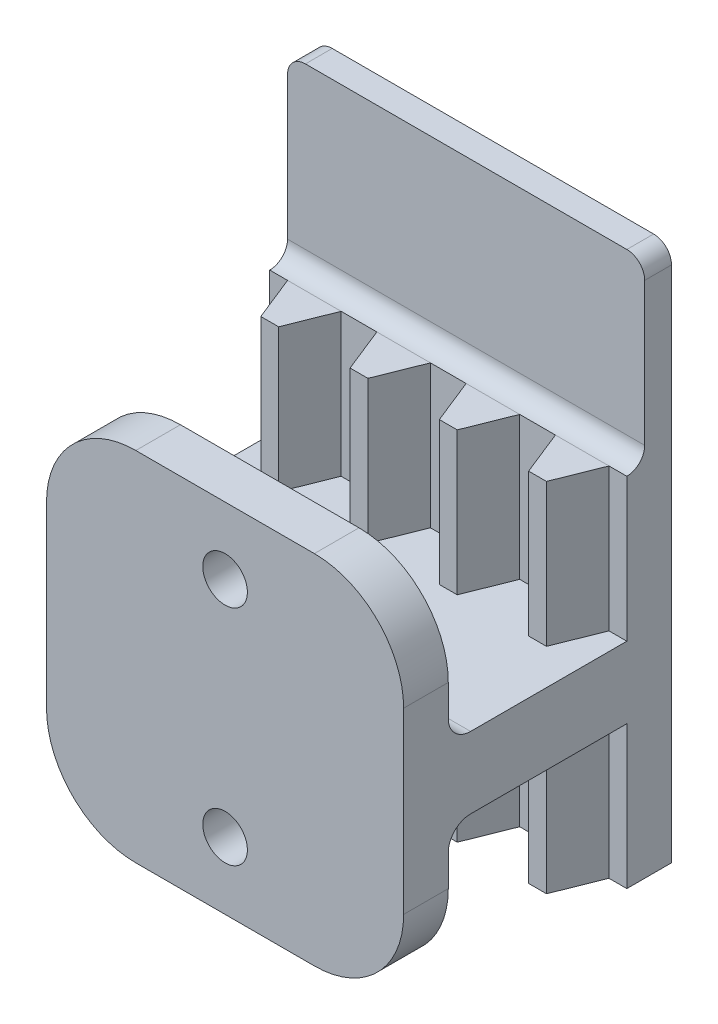
from build123d import *

# Parameters (mm, degrees)
BOSS_EXTRUDE1_DEPTH      = 40
SKETCH2_W                = 40
SKETCH2_H                = 3
BOSS_EXTRUDE2_DEPTH      = 60
BOSS_EXTRUDE3_DEPTH      = 15
BOSS_EXTRUDE3_DEPTH_BACK = 10
SKETCH3_W                = 40
SKETCH3_H                = 8
SKETCH4_W                = 40
SKETCH4_H                = 5
BOSS_EXTRUDE4_DEPTH      = 40
SKETCH5_R                = 2.5
CUT_EXTRUDE1_DEPTH       = 40
FILLET1_R                = 10
FILLET2_R                = 2.5
FILLET3_START            = -7
FILLET3_DEPTH            = 40
FILLET4_R                = 2


with BuildPart() as part:
    # Sketch1 → Boss-Extrude1 (new body)
    with BuildSketch(Plane(origin=(0, 0, 0), x_dir=(1, 0, 0), z_dir=(0, 1, 0))):
        Polygon((-7, 10), (-7, 5), (-5, 5), (-3, 0), (-1, 0), (1, 5), (5, 5), (7, 0), (9, 0), (11, 5), (15, 5), (17, 0), (19, 0), (21, 5), (25, 5), (27, 0), (29, 0), (31, 5), (33, 5), (33, 10), (31.5, 10), align=None)
    extrude(amount=BOSS_EXTRUDE1_DEPTH)

    # Sketch2 → Boss-Extrude2 (add)
    with BuildSketch(Plane(origin=(0, 0, 0), x_dir=(1, 0, 0), z_dir=(0, 1, 0))):
        with Locations((13, 8.5)):
            Rectangle(SKETCH2_W, SKETCH2_H)
    extrude(amount=BOSS_EXTRUDE2_DEPTH)

    # Sketch3 → Boss-Extrude3 (add, two sides: drawn at the far end of the back side and taken through both)
    with BuildSketch(Plane.XY.offset(-BOSS_EXTRUDE3_DEPTH_BACK)):
        with Locations((13, 20)):
            Rectangle(SKETCH3_W, SKETCH3_H)
    extrude(amount=BOSS_EXTRUDE3_DEPTH + BOSS_EXTRUDE3_DEPTH_BACK)

    # Sketch4 → Boss-Extrude4 (add)
    with BuildSketch(Plane(origin=(0, 0, 0), x_dir=(1, 0, 0), z_dir=(0, 1, 0))):
        with Locations((13, -17.5)):
            Rectangle(SKETCH4_W, SKETCH4_H)
    extrude(amount=BOSS_EXTRUDE4_DEPTH)

    # Sketch5 → Cut-Extrude1 (cut)
    with BuildSketch(Plane.XY.offset(10)):
        with Locations(Location((13, 32.5, 0), (0, 0, 180))):
            Circle(SKETCH5_R)
        with Locations(Location((13, 7.5, 0), (0, 0, 180))):
            Circle(SKETCH5_R)
    extrude(amount=CUT_EXTRUDE1_DEPTH, mode=Mode.SUBTRACT)

    # Fillet1
    fillet1_edges = [part.edges().sort_by_distance(p)[0] for p in [
        (-7, 0, 17.5),
        (33, 0, 17.5),
        (33, 40, 17.5),
        (-7, 40, 17.5),
    ]]
    fillet(fillet1_edges, radius=FILLET1_R)

    # Fillet2
    fillet2_edges = [part.edges().sort_by_distance(p)[0] for p in [
        (13, 16, 15),
        (13, 24, 15),
    ]]
    fillet(fillet2_edges, radius=FILLET2_R)

    # Fillet3: read off the stored shape, not the designer's step
    # Fillet3 outline → Fillet3 (add)
    with BuildSketch(Plane.YZ.offset(FILLET3_START)):
        with BuildLine():
            Line((40, -7), (42, -7))
            ThreePointArc((42, -7), (40.585786438, -6.414213562), (40, -5))
            Line((40, -5), (40, -7))
        make_face()
    extrude(amount=FILLET3_DEPTH)

    # Fillet4
    fillet4_edges = [part.edges().sort_by_distance(p)[0] for p in [
        (-7, 60, -8.5),
        (33, 60, -8.5),
    ]]
    fillet(fillet4_edges, radius=FILLET4_R)


solid = part.part
